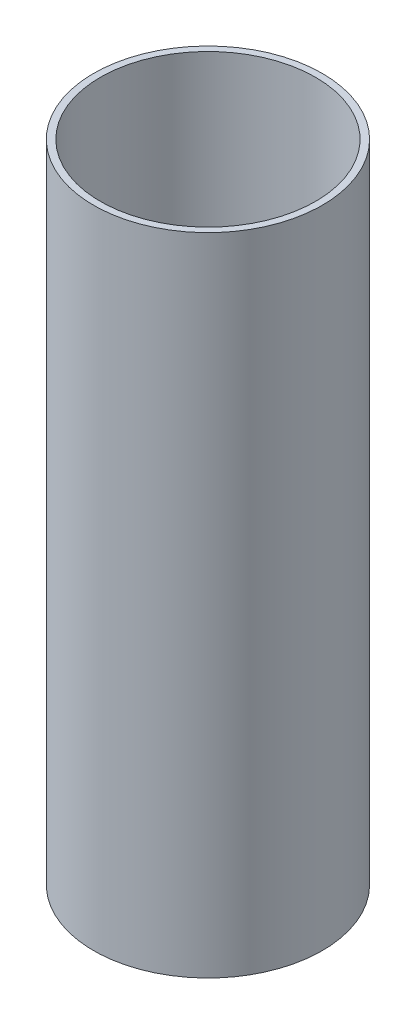
from build123d import *

# Parameters (mm, degrees)
SKETCH1_W = 1.5875
SKETCH1_H = 152.4


with BuildPart() as part:
    # Sketch1 → Revolve1 (revolve)
    with BuildSketch(Plane.XY):
        with Locations((26.19375, -25.69399608)):
            Rectangle(SKETCH1_W, SKETCH1_H)
    revolve(axis=Axis((0, 0, 0), (0, 1, 0)))


solid = part.part
